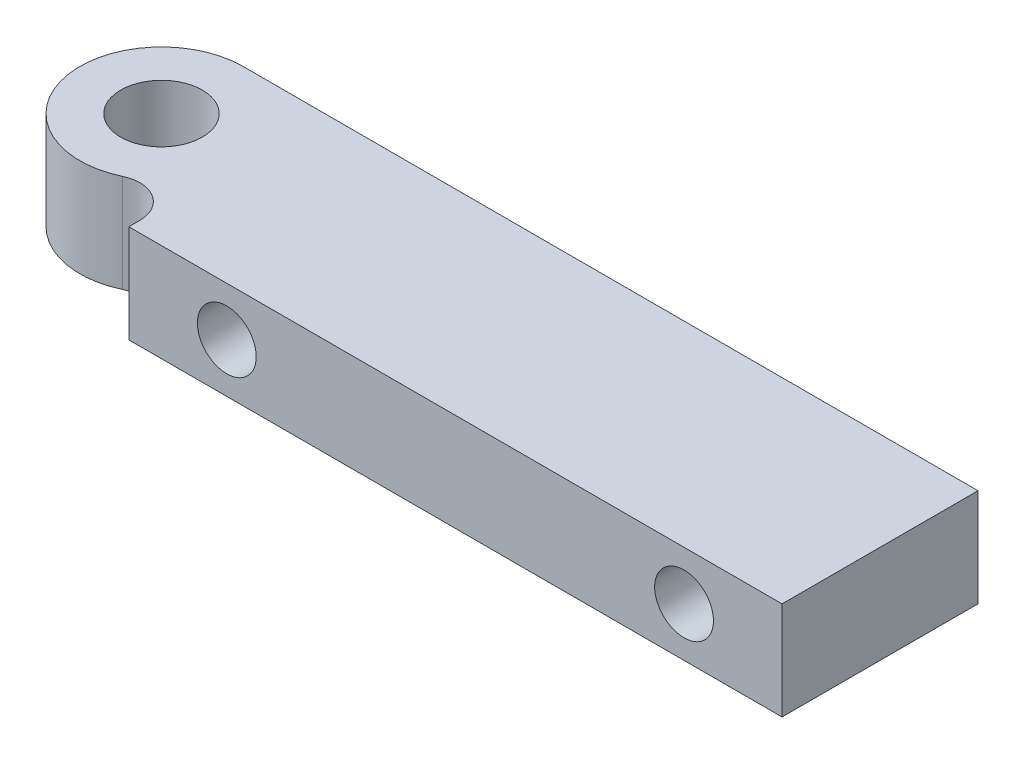
from build123d import *

# Parameters (mm, degrees)
SKETCH1_R           = 3.175
BOSS_EXTRUDE1_DEPTH = 3.8099999999999996
FILLET1_R           = 2.54
SKETCH2_R           = 2.285999999998778
SKETCH2_R_2         = 2.2859999999987846
CUT_EXTRUDE1_DEPTH  = 5.08


with BuildPart() as part:
    # Sketch1 → Boss-Extrude1 (new, symmetric)
    with BuildSketch(Plane(origin=(0, 0, 0), x_dir=(1, 0, 0), z_dir=(0, 1, 0))):
        with BuildLine():
            Line((0, 6.35), (12.366459894249573, 6.35))
            Line((12.366459894249573, 6.35), (57.15, 6.35))
            Line((57.15, 6.35), (57.15, -8.889999999999999))
            Line((57.15, -8.889999999999999), (6.350000000000001, -8.889999999999999))
            Line((6.350000000000001, -8.889999999999999), (6.3500000000000005, 8.7e-16))
            ThreePointArc((6.3500000000000005, 8.7e-16), (-4.490128060534578, -4.490128060534576), (0, 6.35))
        make_face()
        Circle(SKETCH1_R, mode=Mode.SUBTRACT)
    extrude(amount=BOSS_EXTRUDE1_DEPTH, both=True)

    # Fillet1
    fillet1_edges = [part.edges().sort_by_distance(p)[0] for p in [
        (6.350000000000001, 0, -8.7e-16),
    ]]
    fillet(fillet1_edges, radius=FILLET1_R)

    # Sketch2 → Cut-Extrude1 (cut)
    with BuildSketch(Plane.XY.offset(8.889999999999999)):
        with Locations((49.53000000000141, -2.17e-15)):
            Circle(SKETCH2_R)
        with Locations((13.97000000000137, -2.17e-15)):
            Circle(SKETCH2_R_2)
    extrude(amount=-CUT_EXTRUDE1_DEPTH, mode=Mode.SUBTRACT)


solid = part.part
